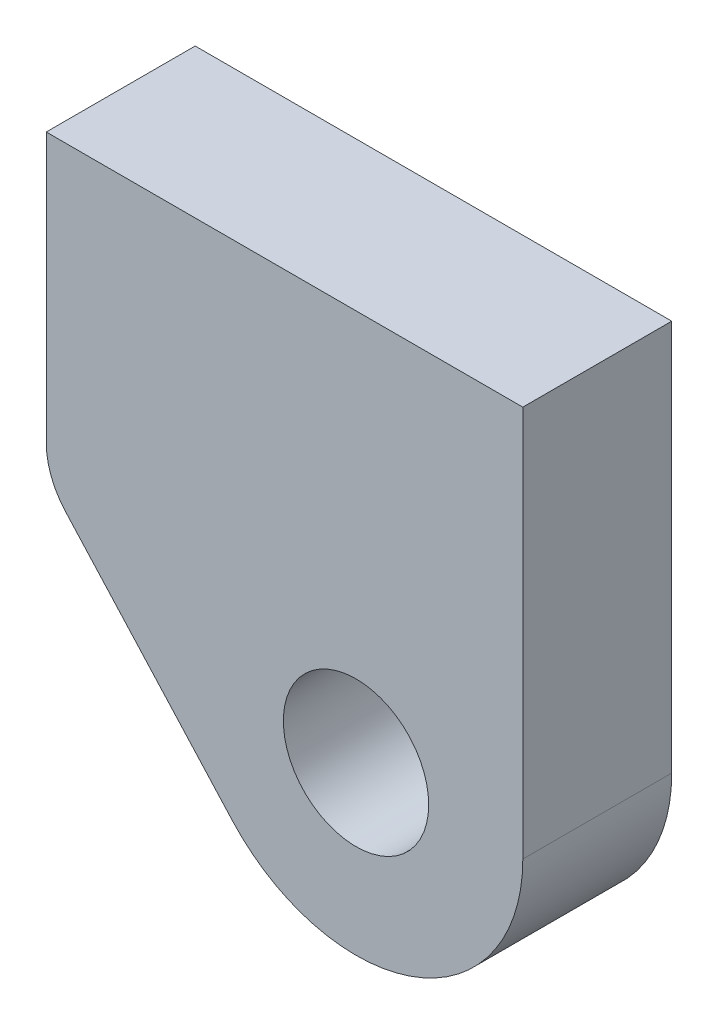
from build123d import *

# Parameters (mm, degrees)
SKETCH1_R           = 1.5494
BOSS_EXTRUDE1_DEPTH = 1.5875


with BuildPart() as part:
    # Sketch1 → Boss-Extrude1 (new, symmetric)
    with BuildSketch(Plane.XY):
        with BuildLine():
            Line((5.08, 0), (-5.08, 0))
            Line((-5.08, 0), (-5.08, -5.737908239))
            ThreePointArc((-5.08, -5.737908239), (-4.973712071, -6.309018604), (-4.669080882, -6.803653836))
            Line((-4.669080882, -6.803653836), (-1.111541176, -10.731170137))
            ThreePointArc((-1.111541176, -10.731170137), (2.803287219, -11.66181504), (5.08, -8.3439))
            Line((5.08, -8.3439), (5.08, 0))
        make_face()
        with Locations((1.524, -8.3439)):
            Circle(SKETCH1_R, mode=Mode.SUBTRACT)
    extrude(amount=BOSS_EXTRUDE1_DEPTH, both=True)


solid = part.part
